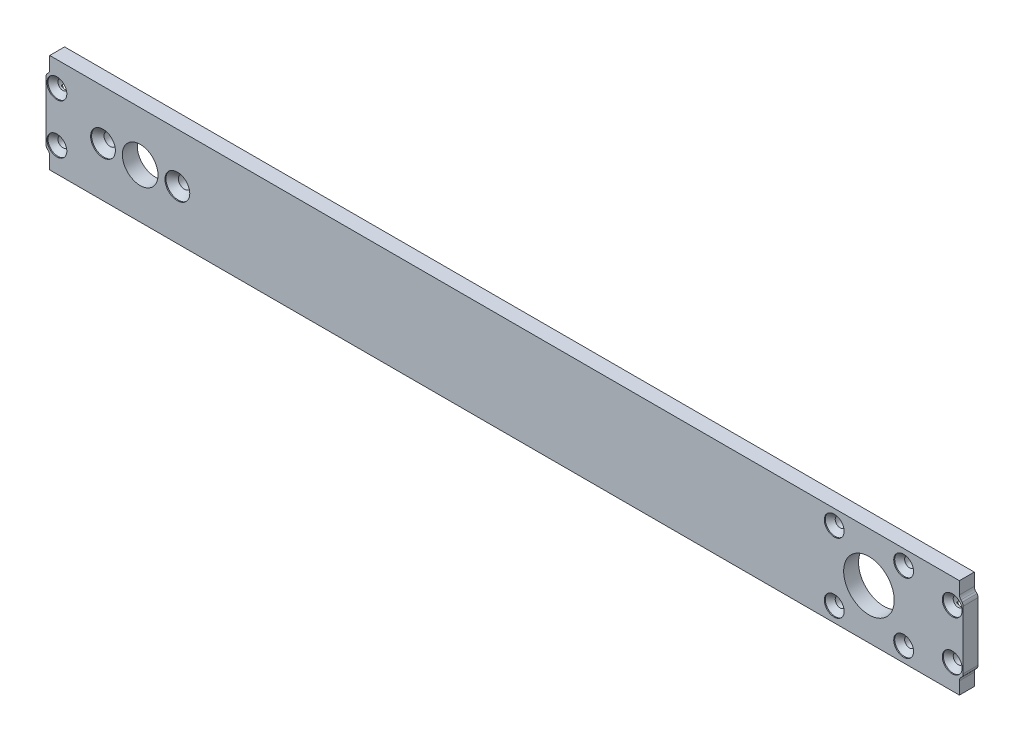
from build123d import *
from build123d.topology import SkipClean

# Parameters (mm, degrees)
SKETCH1_W                    = 185
SKETCH1_H                    = 20
BASE_SHAPE_DEPTH             = 3
MOTOR_CUTOUTS_REACH          = 95.087
SKETCH2_R                    = 1.25
SKETCH2_R_2                  = 3.6
SKETCH2_R_3                  = 5.1
SKETCH2_R_4                  = 1
PCB_SLOT_DEPTH               = 0.775
END_PLATE_HOLES_REACH        = 95.087
SKETCH6_R                    = 1
M2_5_COUNTERSUNKS_AT_2_COUNT = 2
M2_5_COUNTERSUNKS_AT_2_PITCH = 15
M2_COUNTERSUNKS_AT_2_COUNT   = 2
M2_COUNTERSUNKS_AT_2_PITCH   = 10
M2_COUNTERSUNKS_AT_3_COUNT   = 2
M2_COUNTERSUNKS_AT_3_PITCH   = 180.6
M2_COUNTERSUNKS_AT_4_COUNT   = 2
M2_COUNTERSUNKS_AT_4_PITCH   = 180.876643047
M2_COUNTERSUNKS_AT_5_COUNT   = 2
M2_COUNTERSUNKS_AT_5_PITCH   = 15.493224325
M2_COUNTERSUNKS_AT_6_COUNT   = 2
M2_COUNTERSUNKS_AT_6_PITCH   = 26.654080363
M2_COUNTERSUNKS_AT_7_COUNT   = 2
M2_COUNTERSUNKS_AT_7_PITCH   = 23.883885781
M2_COUNTERSUNKS_AT_8_COUNT   = 2
M2_COUNTERSUNKS_AT_8_PITCH   = 10.0019998
TAP_START                    = -1.4
TAP_SLOTS_DEPTH              = 1.4
CUT_EXTRUDE3_REACH           = 95.087
FILLET1_R                    = 1


with BuildPart() as part:
    # Sketch1 → Base shape (new body)
    with BuildSketch(Plane.XY):
        Rectangle(SKETCH1_W, SKETCH1_H)
    extrude(amount=-BASE_SHAPE_DEPTH)

    # Sketch2 → Motor cutouts (cut, up to next)
    with BuildSketch(Plane.XY, mode=Mode.PRIVATE) as motor_cutouts_sk1:
        with Locations((-81, 0)):
            Circle(SKETCH2_R)
    motor_cutouts_tool1 = extrude(motor_cutouts_sk1.sketch, amount=-MOTOR_CUTOUTS_REACH, mode=Mode.PRIVATE) & part.part
    # Sketch2 → Motor cutouts (cut, up to next)
    with BuildSketch(Plane.XY, mode=Mode.PRIVATE) as motor_cutouts_sk2:
        with Locations((-66, 0)):
            Circle(SKETCH2_R)
    motor_cutouts_tool2 = extrude(motor_cutouts_sk2.sketch, amount=-MOTOR_CUTOUTS_REACH, mode=Mode.PRIVATE) & part.part
    # Sketch2 → Motor cutouts (cut, up to next)
    with BuildSketch(Plane.XY, mode=Mode.PRIVATE) as motor_cutouts_sk3:
        with Locations((-73.5, 0)):
            Circle(SKETCH2_R_2)
    motor_cutouts_tool3 = extrude(motor_cutouts_sk3.sketch, amount=-MOTOR_CUTOUTS_REACH, mode=Mode.PRIVATE) & part.part
    # Sketch2 → Motor cutouts (cut, up to next)
    with BuildSketch(Plane.XY, mode=Mode.PRIVATE) as motor_cutouts_sk4:
        with Locations((73.5, 0)):
            Circle(SKETCH2_R_3)
    motor_cutouts_tool4 = extrude(motor_cutouts_sk4.sketch, amount=-MOTOR_CUTOUTS_REACH, mode=Mode.PRIVATE) & part.part
    # Sketch2 → Motor cutouts (cut, up to next)
    with BuildSketch(Plane.XY, mode=Mode.PRIVATE) as motor_cutouts_sk5:
        with Locations((66.5, 7)):
            Circle(SKETCH2_R_4)
    motor_cutouts_tool5 = extrude(motor_cutouts_sk5.sketch, amount=-MOTOR_CUTOUTS_REACH, mode=Mode.PRIVATE) & part.part
    # Sketch2 → Motor cutouts (cut, up to next)
    with BuildSketch(Plane.XY, mode=Mode.PRIVATE) as motor_cutouts_sk6:
        with Locations((80.5, 7)):
            Circle(SKETCH2_R_4)
    motor_cutouts_tool6 = extrude(motor_cutouts_sk6.sketch, amount=-MOTOR_CUTOUTS_REACH, mode=Mode.PRIVATE) & part.part
    # Sketch2 → Motor cutouts (cut, up to next)
    with BuildSketch(Plane.XY, mode=Mode.PRIVATE) as motor_cutouts_sk7:
        with Locations((80.5, -7)):
            Circle(SKETCH2_R_4)
    motor_cutouts_tool7 = extrude(motor_cutouts_sk7.sketch, amount=-MOTOR_CUTOUTS_REACH, mode=Mode.PRIVATE) & part.part
    # Sketch2 → Motor cutouts (cut, up to next)
    with BuildSketch(Plane.XY, mode=Mode.PRIVATE) as motor_cutouts_sk8:
        with Locations((66.5, -7)):
            Circle(SKETCH2_R_4)
    motor_cutouts_tool8 = extrude(motor_cutouts_sk8.sketch, amount=-MOTOR_CUTOUTS_REACH, mode=Mode.PRIVATE) & part.part
    add(motor_cutouts_tool1.solids().sort_by_distance((-81, 0, 0))[0], mode=Mode.SUBTRACT)
    add(motor_cutouts_tool2.solids().sort_by_distance((-66, 0, 0))[0], mode=Mode.SUBTRACT)
    add(motor_cutouts_tool3.solids().sort_by_distance((-73.5, 0, 0))[0], mode=Mode.SUBTRACT)
    add(motor_cutouts_tool4.solids().sort_by_distance((73.5, 0, 0))[0], mode=Mode.SUBTRACT)
    add(motor_cutouts_tool5.solids().sort_by_distance((66.5, 7, 0))[0], mode=Mode.SUBTRACT)
    add(motor_cutouts_tool6.solids().sort_by_distance((80.5, 7, 0))[0], mode=Mode.SUBTRACT)
    add(motor_cutouts_tool7.solids().sort_by_distance((80.5, -7, 0))[0], mode=Mode.SUBTRACT)
    add(motor_cutouts_tool8.solids().sort_by_distance((66.5, -7, 0))[0], mode=Mode.SUBTRACT)

    # Sketch5 → PCB slot (cut)
    with BuildSketch(Plane(origin=(0, 0, -3), x_dir=(-1, 0, 0), z_dir=(0, 0, -1))):
        with BuildLine():
            Line((-60, -6), (60, -6))
            ThreePointArc((60, -6), (61, -7), (60, -8))
            Line((60, -8), (-60, -8))
            ThreePointArc((-60, -8), (-61, -7), (-60, -6))
        make_face()
    extrude(amount=-PCB_SLOT_DEPTH, mode=Mode.SUBTRACT)

    # Sketch6 → End plate holes (cut, up to next)
    with BuildSketch(Plane.XY, mode=Mode.PRIVATE) as end_plate_holes_sk1:
        with Locations((90.3, 5)):
            Circle(SKETCH6_R)
    end_plate_holes_tool1 = extrude(end_plate_holes_sk1.sketch, amount=-END_PLATE_HOLES_REACH, mode=Mode.PRIVATE) & part.part
    # Sketch6 → End plate holes (cut, up to next)
    with BuildSketch(Plane.XY, mode=Mode.PRIVATE) as end_plate_holes_sk2:
        with Locations((90.3, -5)):
            Circle(SKETCH6_R)
    end_plate_holes_tool2 = extrude(end_plate_holes_sk2.sketch, amount=-END_PLATE_HOLES_REACH, mode=Mode.PRIVATE) & part.part
    # Sketch6 → End plate holes (cut, up to next)
    with BuildSketch(Plane.XY, mode=Mode.PRIVATE) as end_plate_holes_sk3:
        with Locations((-90.3, -5)):
            Circle(SKETCH6_R)
    end_plate_holes_tool3 = extrude(end_plate_holes_sk3.sketch, amount=-END_PLATE_HOLES_REACH, mode=Mode.PRIVATE) & part.part
    # Sketch6 → End plate holes (cut, up to next)
    with BuildSketch(Plane.XY, mode=Mode.PRIVATE) as end_plate_holes_sk4:
        with Locations((-90.3, 5)):
            Circle(SKETCH6_R)
    end_plate_holes_tool4 = extrude(end_plate_holes_sk4.sketch, amount=-END_PLATE_HOLES_REACH, mode=Mode.PRIVATE) & part.part
    add(end_plate_holes_tool1.solids().sort_by_distance((90.3, 5, 0))[0], mode=Mode.SUBTRACT)
    add(end_plate_holes_tool2.solids().sort_by_distance((90.3, -5, 0))[0], mode=Mode.SUBTRACT)
    add(end_plate_holes_tool3.solids().sort_by_distance((-90.3, -5, 0))[0], mode=Mode.SUBTRACT)
    add(end_plate_holes_tool4.solids().sort_by_distance((-90.3, 5, 0))[0], mode=Mode.SUBTRACT)

    # Sketch4 → M2.5 countersunks (revolve, cut)
    with BuildSketch(Plane(origin=(-81, 0, 0), x_dir=(0, -1, 0), z_dir=(1, 0, 0))):
        Polygon((0, 0), (0, 3), (1.25, 3), (1.25, 1.45), (2.5, 0.2), (2.5, 0), align=None)
    m2_5_countersunks = revolve(axis=Axis((-81, 0, 6.35), (0, 0, -1)), mode=Mode.SUBTRACT)

    # M2.5 countersunks at 2: M2.5 countersunks ×2
    with Locations(*[(i * M2_5_COUNTERSUNKS_AT_2_PITCH, 0, 0) for i in range(1, M2_5_COUNTERSUNKS_AT_2_COUNT)]):
        add(m2_5_countersunks, mode=Mode.SUBTRACT)

    # Sketch9 → M2 countersunks (revolve, cut)
    with BuildSketch(Plane(origin=(90.3, 5, 0), x_dir=(0, -1, 0), z_dir=(1, 0, 0))):
        Polygon((0, 0), (0, 3), (1, 3), (1, 1.2), (2, 0.2), (2, 0), align=None)
    m2_countersunks = revolve(axis=Axis((90.3, 5, 6.35), (0, 0, -1)), mode=Mode.SUBTRACT)

    # M2 countersunks at 2: M2 countersunks ×2
    with Locations(*[(0, -i * M2_COUNTERSUNKS_AT_2_PITCH, 0) for i in range(1, M2_COUNTERSUNKS_AT_2_COUNT)]):
        add(m2_countersunks, mode=Mode.SUBTRACT)

    # M2 countersunks at 3: M2 countersunks ×2
    with Locations(*[(-i * M2_COUNTERSUNKS_AT_3_PITCH, 0, 0) for i in range(1, M2_COUNTERSUNKS_AT_3_COUNT)]):
        add(m2_countersunks, mode=Mode.SUBTRACT)

    # M2 countersunks at 4: M2 countersunks ×2
    with Locations(*[Vector(-0.9984705430039356, -0.055286298062233535, 0) * (i * M2_COUNTERSUNKS_AT_4_PITCH) for i in range(1, M2_COUNTERSUNKS_AT_4_COUNT)]):
        add(m2_countersunks, mode=Mode.SUBTRACT)

    # M2 countersunks at 5: M2 countersunks ×2
    with Locations(*[Vector(-0.6325345708624244, -0.774532127586641, 0) * (i * M2_COUNTERSUNKS_AT_5_PITCH) for i in range(1, M2_COUNTERSUNKS_AT_5_COUNT)]):
        add(m2_countersunks, mode=Mode.SUBTRACT)

    # M2 countersunks at 6: M2 countersunks ×2
    with Locations(*[Vector(-0.892921446766261, -0.45021249416786235, 0) * (i * M2_COUNTERSUNKS_AT_6_PITCH) for i in range(1, M2_COUNTERSUNKS_AT_6_COUNT)]):
        add(m2_countersunks, mode=Mode.SUBTRACT)

    # M2 countersunks at 7: M2 countersunks ×2
    with Locations(*[Vector(-0.9964877666150214, 0.08373846778277487, 0) * (i * M2_COUNTERSUNKS_AT_7_PITCH) for i in range(1, M2_COUNTERSUNKS_AT_7_COUNT)]):
        add(m2_countersunks, mode=Mode.SUBTRACT)

    # M2 countersunks at 8: M2 countersunks ×2
    with Locations(*[Vector(-0.979804058780407, 0.19996001199600139, 0) * (i * M2_COUNTERSUNKS_AT_8_PITCH) for i in range(1, M2_COUNTERSUNKS_AT_8_COUNT)]):
        add(m2_countersunks, mode=Mode.SUBTRACT)

    # Sketch12 → Tap slots (cut)
    with SkipClean():  # the faces are left unmerged after this step: merging them gives an invalid solid
        with BuildSketch(Plane(origin=(0, 0, -3), x_dir=(-1, 0, 0), z_dir=(0, 0, -1)).offset(TAP_START)):
            with BuildLine():
                Line((-91.9, 2.635786438), (-91.9, -2.635786438))
                ThreePointArc((-91.9, -2.635786438), (-92.085607903, -3.793515558), (-91.043923255, -4.33173494))
                ThreePointArc((-91.043923255, -4.33173494), (-91.048881163, -4.337295689), (-91.053797505, -4.342893219))
                Line((-91.053797505, -4.342893219), (-89.546202495, -4.342893219))
                ThreePointArc((-89.546202495, -4.342893219), (-89.551118837, -4.337295689), (-89.556076745, -4.33173494))
                ThreePointArc((-89.556076745, -4.33173494), (-88.514392097, -3.793515558), (-88.7, -2.635786438))
                Line((-88.7, -2.635786438), (-88.7, 2.635786438))
                ThreePointArc((-88.7, 2.635786438), (-88.514392097, 3.793515558), (-89.556076745, 4.33173494))
                ThreePointArc((-89.556076745, 4.33173494), (-89.551118837, 4.337295689), (-89.546202495, 4.342893219))
                Line((-89.546202495, 4.342893219), (-91.053797505, 4.342893219))
                ThreePointArc((-91.053797505, 4.342893219), (-91.048881163, 4.337295689), (-91.043923255, 4.33173494))
                ThreePointArc((-91.043923255, 4.33173494), (-92.085607903, 3.793515558), (-91.9, 2.635786438))
            make_face()
            with BuildLine():
                Line((91.9, -2.635786438), (91.9, 2.635786438))
                ThreePointArc((91.9, 2.635786438), (92.085607903, 3.793515558), (91.043923255, 4.33173494))
                ThreePointArc((91.043923255, 4.33173494), (91.048881163, 4.337295689), (91.053797505, 4.342893219))
                Line((91.053797505, 4.342893219), (89.546202495, 4.342893219))
                ThreePointArc((89.546202495, 4.342893219), (89.551118837, 4.337295689), (89.556076745, 4.33173494))
                ThreePointArc((89.556076745, 4.33173494), (88.514392097, 3.793515558), (88.7, 2.635786438))
                Line((88.7, 2.635786438), (88.7, -2.635786438))
                ThreePointArc((88.7, -2.635786438), (88.514392097, -3.793515558), (89.556076745, -4.33173494))
                ThreePointArc((89.556076745, -4.33173494), (89.551118837, -4.337295689), (89.546202495, -4.342893219))
                Line((89.546202495, -4.342893219), (91.053797505, -4.342893219))
                ThreePointArc((91.053797505, -4.342893219), (91.048881163, -4.337295689), (91.043923255, -4.33173494))
                ThreePointArc((91.043923255, -4.33173494), (92.085607903, -3.793515558), (91.9, -2.635786438))
            make_face()
        extrude(amount=TAP_SLOTS_DEPTH, mode=Mode.SUBTRACT)

    # Sketch13 → Cut-Extrude3 (cut, up to next)
    with BuildSketch(Plane.XY, mode=Mode.PRIVATE) as cut_extrude3_sk1:
        with BuildLine():
            Line((-91.75, 10), (-92.5, 10))
            Line((-92.5, 10), (-92.5, 6.187434209))
            ThreePointArc((-92.5, 6.187434209), (-92.173731748, 6.655031521), (-91.75, 7.036541185))
            Line((-91.75, 7.036541185), (-91.75, 10))
        make_face()
    cut_extrude3_tool1 = extrude(cut_extrude3_sk1.sketch, amount=-CUT_EXTRUDE3_REACH, mode=Mode.PRIVATE) & part.part
    # Sketch13 → Cut-Extrude3 (cut, up to next)
    with BuildSketch(Plane.XY, mode=Mode.PRIVATE) as cut_extrude3_sk2:
        with BuildLine():
            Line((92.5, 10), (91.75, 10))
            Line((91.75, 10), (91.75, 7.036541185))
            ThreePointArc((91.75, 7.036541185), (92.173731748, 6.655031521), (92.5, 6.187434209))
            Line((92.5, 6.187434209), (92.5, 10))
        make_face()
    cut_extrude3_tool2 = extrude(cut_extrude3_sk2.sketch, amount=-CUT_EXTRUDE3_REACH, mode=Mode.PRIVATE) & part.part
    # Sketch13 → Cut-Extrude3 (cut, up to next)
    with BuildSketch(Plane.XY, mode=Mode.PRIVATE) as cut_extrude3_sk3:
        with BuildLine():
            ThreePointArc((-91.75, -7.036541185), (-92.173731748, -6.655031521), (-92.5, -6.187434209))
            Line((-92.5, -6.187434209), (-92.5, -10))
            Line((-92.5, -10), (-91.75, -10))
            Line((-91.75, -10), (-91.75, -7.036541185))
        make_face()
    cut_extrude3_tool3 = extrude(cut_extrude3_sk3.sketch, amount=-CUT_EXTRUDE3_REACH, mode=Mode.PRIVATE) & part.part
    # Sketch13 → Cut-Extrude3 (cut, up to next)
    with BuildSketch(Plane.XY, mode=Mode.PRIVATE) as cut_extrude3_sk4:
        with BuildLine():
            ThreePointArc((92.5, -6.187434209), (92.173731748, -6.655031521), (91.75, -7.036541185))
            Line((91.75, -7.036541185), (91.75, -10))
            Line((91.75, -10), (92.5, -10))
            Line((92.5, -10), (92.5, -6.187434209))
        make_face()
    cut_extrude3_tool4 = extrude(cut_extrude3_sk4.sketch, amount=-CUT_EXTRUDE3_REACH, mode=Mode.PRIVATE) & part.part
    add(cut_extrude3_tool1.solids().sort_by_distance((-92.140588, 8.330084, 0))[0], mode=Mode.SUBTRACT)
    add(cut_extrude3_tool2.solids().sort_by_distance((92.140588, 8.330084, 0))[0], mode=Mode.SUBTRACT)
    add(cut_extrude3_tool3.solids().sort_by_distance((-92.140588, -8.330084, 0))[0], mode=Mode.SUBTRACT)
    add(cut_extrude3_tool4.solids().sort_by_distance((92.140588, -8.330084, 0))[0], mode=Mode.SUBTRACT)

    # Fillet1
    fillet1_edges = [part.edges().sort_by_distance(p)[0] for p in [
        (-91.75, -7.036541185, -1.5),
        (-92.5, -6.187434209, -1.5),
        (-92.5, 6.187434209, -1.5),
        (-91.75, 7.036541185, -1.5),
        (92.5, 6.187434209, -1.5),
        (91.75, 7.036541185, -1.5),
        (92.5, -6.187434209, -1.5),
        (91.75, -7.036541185, -1.5),
    ]]
    fillet(fillet1_edges, radius=FILLET1_R)


solid = part.part
